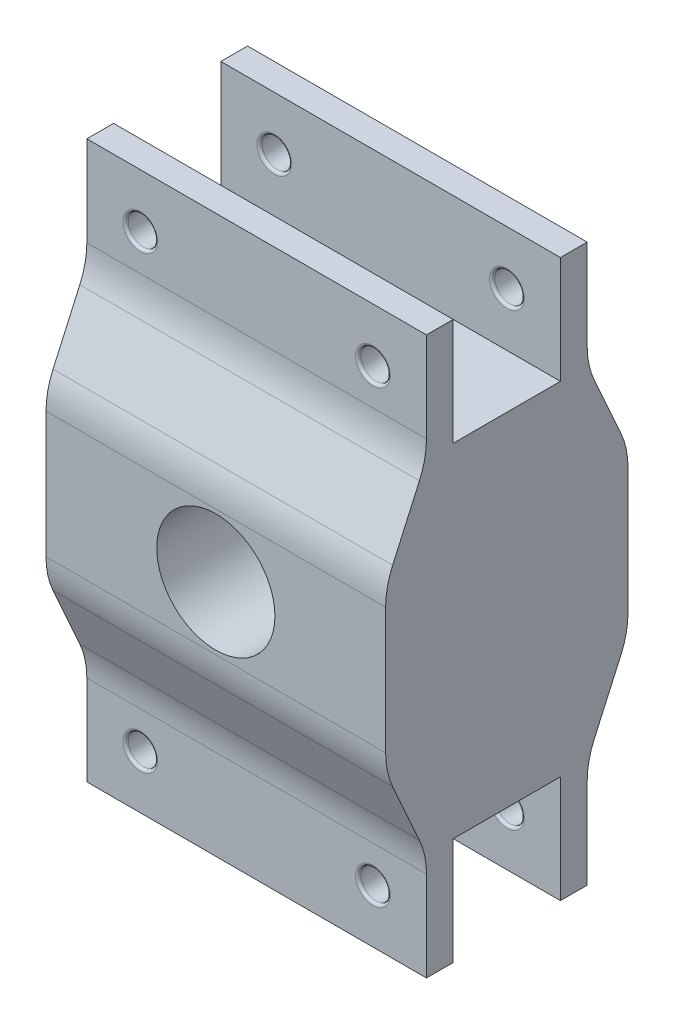
from build123d import *

# Parameters (mm, degrees)
BOSS_EXTRUDE1_DEPTH = 31.75
SKETCH2_R           = 2.75
CUT_EXTRUDE1_DEPTH  = 72.689015031
SKETCH3_R           = 11.049
CUT_EXTRUDE2_DEPTH  = 76.978869534
FILLET1_R           = 0.5
FILLET2_R           = 15


with BuildPart() as part:
    # Sketch1 → Boss-Extrude1 (new, symmetric)
    with BuildSketch(Plane(origin=(0, 0, 0), x_dir=(0, 0, -1), z_dir=(1, 0, 0))):
        Polygon((-15.025, 32.02), (-22.657455813, 15), (-22.657455813, -15), (-15.025, -32.02), (-15.025, -52.07), (-10.025, -52.07), (-10.025, -32.02), (10.025, -32.02), (10.025, -52.07), (15.025, -52.07), (15.025, -32.02), (22.657455813, -15), (22.657455813, 15), (15.025, 32.02), (15.025, 52.07), (10.025, 52.07), (10.025, 32.02), (-10.025, 32.02), (-10.025, 52.07), (-15.025, 52.07), align=None)
    extrude(amount=BOSS_EXTRUDE1_DEPTH, both=True)

    # Sketch2 → Cut-Extrude1 (cut, through all)
    with BuildSketch(Plane.XY.offset(15.025)):
        with Locations((-21.75, 42.07)):
            Circle(SKETCH2_R)
        with Locations((21.75, 42.07)):
            Circle(SKETCH2_R)
    cut_extrude1 = extrude(amount=-CUT_EXTRUDE1_DEPTH, mode=Mode.SUBTRACT)

    # Mirror1: Cut-Extrude1 across plane
    add(cut_extrude1.mirror(Plane.ZX), mode=Mode.SUBTRACT)

    # Sketch3 → Cut-Extrude2 (cut, through all)
    with BuildSketch(Plane.XY.offset(22.657455813)):
        Circle(SKETCH3_R)
    extrude(amount=-CUT_EXTRUDE2_DEPTH, mode=Mode.SUBTRACT)

    # Fillet1
    fillet1_edges = [part.edges().sort_by_distance(p)[0] for p in [
        (-24.5, 42.07, -10.025),
        (19, 42.07, -15.025),
        (19, 42.07, -10.025),
        (19, 42.07, 10.025),
        (19, 42.07, 15.025),
        (-24.5, 42.07, 10.025),
        (-24.5, 42.07, 15.025),
        (19, -42.07, -10.025),
        (19, -42.07, -15.025),
        (-24.5, -42.07, -10.025),
        (-24.5, -42.07, -15.025),
        (19, -42.07, 10.025),
        (19, -42.07, 15.025),
        (-24.5, -42.07, 10.025),
        (-24.5, -42.07, 15.025),
    ]]
    fillet(fillet1_edges, radius=FILLET1_R)

    # Fillet2
    fillet2_edges = [part.edges().sort_by_distance(p)[0] for p in [
        (0, 32.02, -15.025),
        (0, 15, -22.657455813),
        (0, -15, -22.657455813),
        (0, -32.02, -15.025),
        (0, -32.02, 15.025),
        (0, -15, 22.657455813),
        (0, 15, 22.657455813),
        (0, 32.02, 15.025),
    ]]
    fillet(fillet2_edges, radius=FILLET2_R)


solid = part.part
